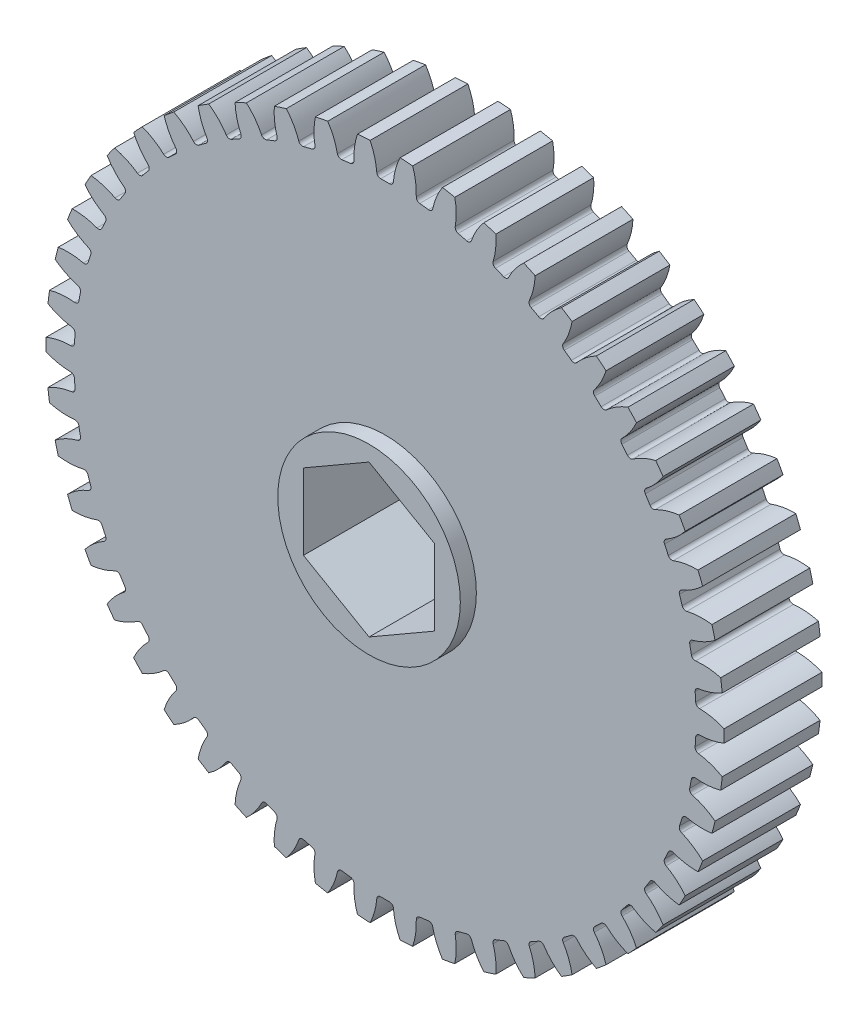
from build123d import *

# Parameters (mm, degrees)
CROQUIS1_R                 = 33.02
SALIENTE_EXTRUIR1_DEPTH    = 4.7625
CORTAR_EXTRUIR1_DEPTH      = 47.939559076
REDONDEO1_R                = 0.381028065
MATRIZC1_COUNT             = 50
REDONDEO1_OF_MATRIZC1_R    = 0.381028065
CROQUIS3_R                 = 8.89
SALIENTE_EXTRUIR2_DEPTH    = 6.3246
CORTAR_EXTRUIR2_DEPTH      = 48.100972908
CORTAR_EXTRUIR2_DEPTH_BACK = 48.100972908


with BuildPart() as part:
    # Croquis1 → Saliente-Extruir1 (new, symmetric)
    with BuildSketch(Plane.XY):
        Circle(CROQUIS1_R)
    extrude(amount=SALIENTE_EXTRUIR1_DEPTH, both=True)

    # Croquis2 → Cortar-Extruir1 (cut, symmetric)
    with BuildSketch(Plane.XY):
        with BuildLine():
            ThreePointArc((0.791556896, 30.270262299), (0, 30.28061), (-0.791556896, 30.270262299))
            ThreePointArc((-0.791556896, 30.270262299), (-0.979843129, 31.665314974), (-1.46278143, 32.987583581))
            ThreePointArc((-1.46278143, 32.987583581), (0, 33.02), (1.46278143, 32.987583581))
            ThreePointArc((1.46278143, 32.987583581), (0.979843129, 31.665314974), (0.791556896, 30.270262299))
        make_face()
    cortar_extruir1 = extrude(amount=CORTAR_EXTRUIR1_DEPTH, both=True, mode=Mode.SUBTRACT)

    # Redondeo1
    redondeo1_edges = [part.edges().sort_by_distance(p)[0] for p in [
        (0.791556896, 30.270262299, 0),
        (-0.791556896, 30.270262299, 0),
    ]]
    fillet(redondeo1_edges, radius=REDONDEO1_R)

    # MatrizC1: Cortar-Extruir1 ×50 about axis
    matrizc1_axis = Axis((0, 0, 4.7625), (0, 0, -1))
    for i in range(1, MATRIZC1_COUNT):
        add(cortar_extruir1.rotate(matrizc1_axis, i * 360 / MATRIZC1_COUNT), mode=Mode.SUBTRACT)

    # Redondeo1 of MatrizC1
    redondeo1_of_matrizc1_edges = [part.edges().sort_by_distance(p)[0] for p in [
        (4.579185088, 29.932363854, 0),
        (3.008554621, 30.130780625, 0),
        (8.294596796, 29.122414151, 0),
        (6.761219435, 29.516118541, 0),
        (11.879197758, 27.853186579, 0),
        (10.407255779, 28.435969636, 0),
        (15.276456674, 26.144697616, 0),
        (13.889163483, 26.907368502, 0),
        (18.432796743, 24.023891154, 0),
        (17.152030781, 24.954422094, 0),
        (21.298440597, 21.524213577, 0),
        (20.144400308, 22.607929542, 0),
        (23.828195319, 18.685086295, 0),
        (22.819080609, 19.904896436, 0),
        (25.982165166, 15.551284039, 0),
        (25.133890377, 16.887951223, 0),
        (27.726380748, 12.172228744, 0),
        (27.052323679, 13.60467293, 0),
        (29.033334742, 8.601210131, 0),
        (28.544125677, 10.106840819, 0),
        (29.882415704, 4.894545295, 0),
        (29.585769761, 6.44961779, 0),
        (30.26023312, 1.110690557, 0),
        (30.160828582, 2.690680435, 0),
        (30.160828582, -2.690680435, 0),
        (30.26023312, -1.110690557, 0),
        (29.585769761, -6.44961779, 0),
        (29.882415704, -4.894545295, 0),
        (28.544125677, -10.106840819, 0),
        (29.033334742, -8.601210131, 0),
        (27.052323679, -13.60467293, 0),
        (27.726380748, -12.172228744, 0),
        (25.133890377, -16.887951223, 0),
        (25.982165166, -15.551284039, 0),
        (22.819080609, -19.904896436, 0),
        (23.828195319, -18.685086295, 0),
        (20.144400308, -22.607929542, 0),
        (21.298440597, -21.524213577, 0),
        (17.152030781, -24.954422094, 0),
        (18.432796743, -24.023891154, 0),
        (13.889163483, -26.907368502, 0),
        (15.276456674, -26.144697616, 0),
        (10.407255779, -28.435969636, 0),
        (11.879197758, -27.853186579, 0),
        (6.761219435, -29.516118541, 0),
        (8.294596796, -29.122414151, 0),
        (3.008554621, -30.130780625, 0),
        (4.579185088, -29.932363854, 0),
        (-0.791556896, -30.270262299, 0),
        (0.791556896, -30.270262299, 0),
        (-4.579185088, -29.932363854, 0),
        (-3.008554621, -30.130780625, 0),
        (-8.294596796, -29.122414151, 0),
        (-6.761219435, -29.516118541, 0),
        (-11.879197758, -27.853186579, 0),
        (-10.407255779, -28.435969636, 0),
        (-15.276456674, -26.144697616, 0),
        (-13.889163483, -26.907368502, 0),
        (-18.432796743, -24.023891154, 0),
        (-17.152030781, -24.954422094, 0),
        (-21.298440597, -21.524213577, 0),
        (-20.144400308, -22.607929542, 0),
        (-23.828195319, -18.685086295, 0),
        (-22.819080609, -19.904896436, 0),
        (-25.982165166, -15.551284039, 0),
        (-25.133890377, -16.887951223, 0),
        (-27.726380748, -12.172228744, 0),
        (-27.052323679, -13.60467293, 0),
        (-29.033334742, -8.601210131, 0),
        (-28.544125677, -10.106840819, 0),
        (-29.882415704, -4.894545295, 0),
        (-29.585769761, -6.44961779, 0),
        (-30.26023312, -1.110690557, 0),
        (-30.160828582, -2.690680435, 0),
        (-30.160828582, 2.690680435, 0),
        (-30.26023312, 1.110690557, 0),
        (-29.585769761, 6.44961779, 0),
        (-29.882415704, 4.894545295, 0),
        (-28.544125677, 10.106840819, 0),
        (-29.033334742, 8.601210131, 0),
        (-27.052323679, 13.60467293, 0),
        (-27.726380748, 12.172228744, 0),
        (-25.133890377, 16.887951223, 0),
        (-25.982165166, 15.551284039, 0),
        (-22.819080609, 19.904896436, 0),
        (-23.828195319, 18.685086295, 0),
        (-20.144400308, 22.607929542, 0),
        (-21.298440597, 21.524213577, 0),
        (-17.152030781, 24.954422094, 0),
        (-18.432796743, 24.023891154, 0),
        (-13.889163483, 26.907368502, 0),
        (-15.276456674, 26.144697616, 0),
        (-10.407255779, 28.435969636, 0),
        (-11.879197758, 27.853186579, 0),
        (-6.761219435, 29.516118541, 0),
        (-8.294596796, 29.122414151, 0),
        (-3.008554621, 30.130780625, 0),
        (-4.579185088, 29.932363854, 0),
    ]]
    fillet(redondeo1_of_matrizc1_edges, radius=REDONDEO1_OF_MATRIZC1_R)

    # Croquis3 → Saliente-Extruir2 (add, symmetric)
    with BuildSketch(Plane.XY):
        Circle(CROQUIS3_R)
    extrude(amount=SALIENTE_EXTRUIR2_DEPTH, both=True)

    # Croquis4 → Cortar-Extruir2 (cut, two sides: drawn at the far end of the back side and taken through both)
    with BuildSketch(Plane.XY.offset(-CORTAR_EXTRUIR2_DEPTH_BACK)):
        Polygon((6.3881, 3.688171255), (0, 7.376342509), (-6.3881, 3.688171255), (-6.3881, -3.688171255), (0, -7.376342509), (6.3881, -3.688171255), align=None)
    extrude(amount=CORTAR_EXTRUIR2_DEPTH + CORTAR_EXTRUIR2_DEPTH_BACK, mode=Mode.SUBTRACT)


solid = part.part
